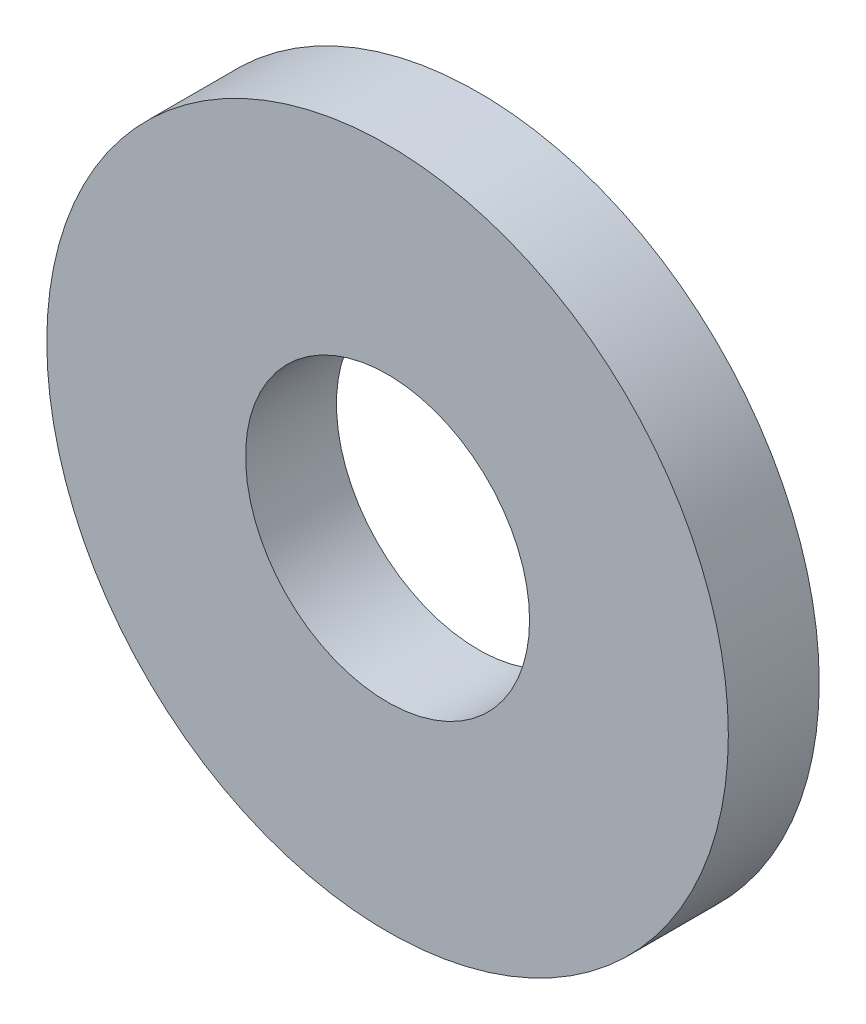
from build123d import *

# Parameters (mm, degrees)
SKETCH1_R           = 4.7625
SKETCH1_R_2         = 1.984375
BOSS_EXTRUDE1_DEPTH = 1.27


with BuildPart() as part:
    # Sketch1 → Boss-Extrude1 (new body)
    with BuildSketch(Plane.XY):
        Circle(SKETCH1_R)
        Circle(SKETCH1_R_2, mode=Mode.SUBTRACT)
    extrude(amount=BOSS_EXTRUDE1_DEPTH)


solid = part.part
